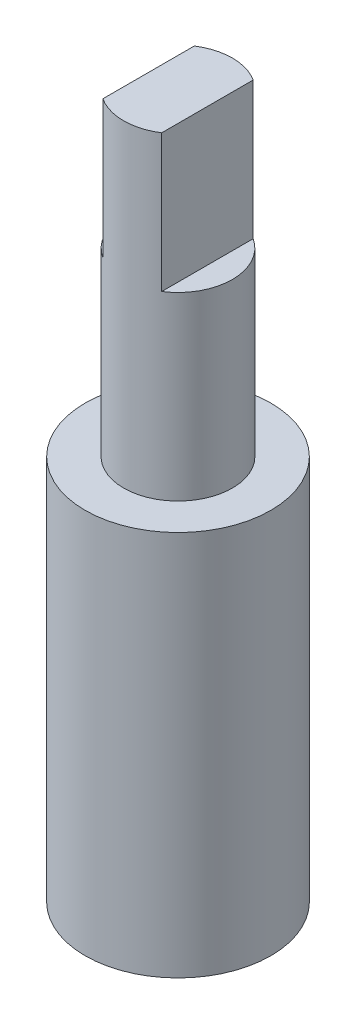
from build123d import *

# Parameters (mm, degrees)
SKETCH1_R           = 3.075
BOSS_EXTRUDE1_DEPTH = 12.77
SKETCH2_R           = 1.8
BOSS_EXTRUDE2_DEPTH = 5.98
BOSS_EXTRUDE3_DEPTH = 4.55
SKETCH4_R           = 2.15
CUT_EXTRUDE1_DEPTH  = 1.95


with BuildPart() as part:
    # Sketch1 → Boss-Extrude1 (new body)
    with BuildSketch(Plane(origin=(0, 0, 0), x_dir=(1, 0, 0), z_dir=(0, 1, 0))):
        Circle(SKETCH1_R)
    extrude(amount=BOSS_EXTRUDE1_DEPTH)

    # Sketch2 → Boss-Extrude2 (add)
    with BuildSketch(Plane(origin=(0, 12.77, 0), x_dir=(1, 0, 0), z_dir=(0, 1, 0))):
        Circle(SKETCH2_R)
    extrude(amount=BOSS_EXTRUDE2_DEPTH)

    # Sketch3 → Boss-Extrude3 (add)
    with BuildSketch(Plane(origin=(0, 18.75, 0), x_dir=(1, 0, 0), z_dir=(0, 1, 0))):
        with BuildLine():
            Line((-0.975, 1.513068075), (-0.975, -1.513068075))
            ThreePointArc((-0.975, -1.513068075), (0, -1.8), (0.975, -1.513068075))
            Line((0.975, -1.513068075), (0.975, 1.513068075))
            ThreePointArc((0.975, 1.513068075), (0, 1.8), (-0.975, 1.513068075))
        make_face()
    extrude(amount=BOSS_EXTRUDE3_DEPTH)

    # Sketch4 → Cut-Extrude1 (cut)
    with BuildSketch(Plane.XZ):
        Circle(SKETCH4_R)
    extrude(amount=-CUT_EXTRUDE1_DEPTH, mode=Mode.SUBTRACT)


solid = part.part
